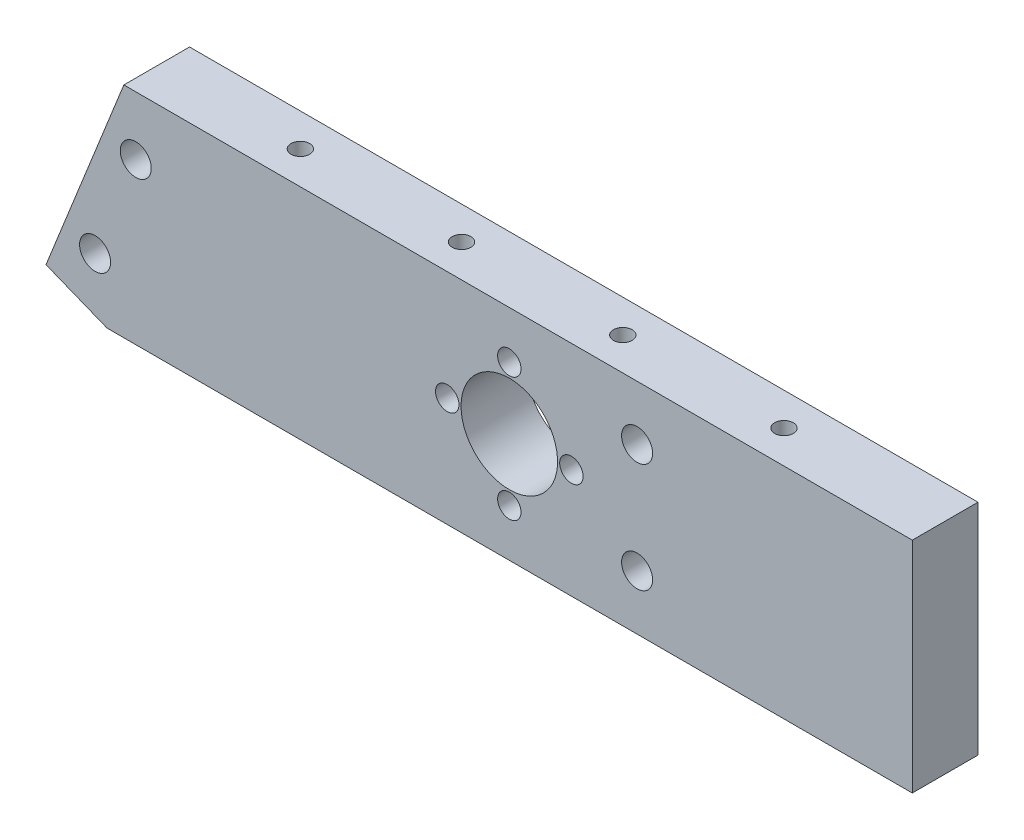
from build123d import *

# Parameters (mm, degrees)
SKETCH1_R           = 1.7
SKETCH1_R_2         = 7
SKETCH1_R_3         = 2.2479
BOSS_EXTRUDE1_DEPTH = 9.525
LPATTERN1_COUNT     = 4
LPATTERN1_PITCH     = 23.368


with BuildPart() as part:
    # Sketch1 → Boss-Extrude1 (new body)
    with BuildSketch(Plane.XY):
        Polygon((-55.88, 15.875), (58.42, 15.875), (58.42, -15.875), (-58.321261042, -15.875), (-67.165001523, -12.337503808), align=None)
        with Locations((0, -9)):
            Circle(SKETCH1_R, mode=Mode.SUBTRACT)
        with Locations((-9, 0)):
            Circle(SKETCH1_R, mode=Mode.SUBTRACT)
        with Locations((0, 9)):
            Circle(SKETCH1_R, mode=Mode.SUBTRACT)
        with Locations((9, 0)):
            Circle(SKETCH1_R, mode=Mode.SUBTRACT)
        Circle(SKETCH1_R_2, mode=Mode.SUBTRACT)
        with Locations((18.525, 7.9375)):
            Circle(SKETCH1_R_3, mode=Mode.SUBTRACT)
        with Locations((18.525, -7.9375)):
            Circle(SKETCH1_R_3, mode=Mode.SUBTRACT)
        with Locations((-54.152717036, 7.369783713)):
            Circle(SKETCH1_R_3, mode=Mode.SUBTRACT)
        with Locations((-60.048544023, -7.369783755)):
            Circle(SKETCH1_R_3, mode=Mode.SUBTRACT)
    extrude(amount=BOSS_EXTRUDE1_DEPTH)

    # Sketch12 → Tap Drill for #6-32 Tap1 (revolve, cut)
    with BuildSketch(Plane(origin=(35.052, -15.875, 4.7625), x_dir=(0, 0, -1), z_dir=(1, 0, 0))):
        Polygon((0, 0), (0, 13.51269403), (1.35255, 12.7), (1.35255, 0), align=None)
    tap_drill_for_6_32_tap1 = revolve(axis=Axis((35.052, -22.225, 4.7625), (0, 1, 0)), mode=Mode.SUBTRACT)

    # LPattern1: Tap Drill for #6-32 Tap1 ×4
    with Locations(*[(-i * LPATTERN1_PITCH, 0, 0) for i in range(1, LPATTERN1_COUNT)]):
        add(tap_drill_for_6_32_tap1, mode=Mode.SUBTRACT)

    # Mirror8: Tap Drill for #6-32 Tap1 across plane
    add(tap_drill_for_6_32_tap1.mirror(Plane.ZX), mode=Mode.SUBTRACT)

    # Mirror8 copy 1 sketch → Mirror8 copy 1 (revolve, cut)
    with BuildSketch(Plane(origin=(11.684, 15.875, 4.7625), x_dir=(0, 0, -1), z_dir=(1, 0, 0))):
        Polygon((0, 0), (0, -13.51269403), (1.35255, -12.7), (1.35255, 0), align=None)
    revolve(axis=Axis((11.684, 22.225, 4.7625), (0, 1, 0)), mode=Mode.SUBTRACT)

    # Mirror8 copy 2 sketch → Mirror8 copy 2 (revolve, cut)
    with BuildSketch(Plane(origin=(-11.684, 15.875, 4.7625), x_dir=(0, 0, -1), z_dir=(1, 0, 0))):
        Polygon((0, 0), (0, -13.51269403), (1.35255, -12.7), (1.35255, 0), align=None)
    revolve(axis=Axis((-11.684, 22.225, 4.7625), (0, 1, 0)), mode=Mode.SUBTRACT)

    # Mirror8 copy 3 sketch → Mirror8 copy 3 (revolve, cut)
    with BuildSketch(Plane(origin=(-35.052, 15.875, 4.7625), x_dir=(0, 0, -1), z_dir=(1, 0, 0))):
        Polygon((0, 0), (0, -13.51269403), (1.35255, -12.7), (1.35255, 0), align=None)
    revolve(axis=Axis((-35.052, 22.225, 4.7625), (0, 1, 0)), mode=Mode.SUBTRACT)


solid = part.part
